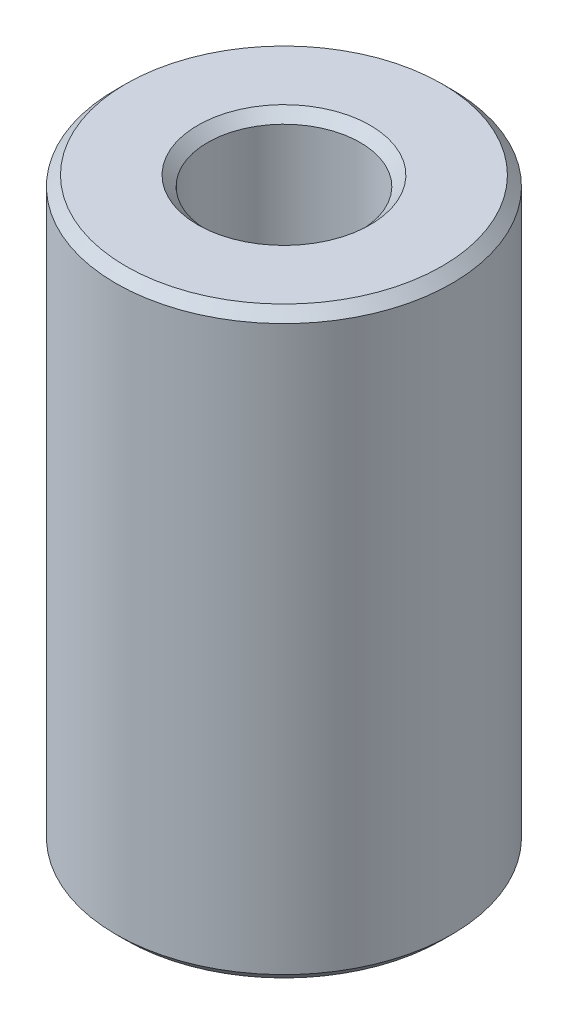
from build123d import *

# Parameters (mm, degrees)
SKETCH1_R           = 5
BOSS_EXTRUDE1_DEPTH = 17.374376269
SKETCH2_R           = 2.271521573
CUT_EXTRUDE1_DEPTH  = 19.758170239
CHAMFER1_SIZE       = 0.295600077


with BuildPart() as part:
    # Sketch1 → Boss-Extrude1 (new body)
    with BuildSketch(Plane(origin=(0, 0, 0), x_dir=(1, 0, 0), z_dir=(0, 1, 0))):
        Circle(SKETCH1_R)
    extrude(amount=BOSS_EXTRUDE1_DEPTH)

    # Sketch2 → Cut-Extrude1 (cut, through all)
    with BuildSketch(Plane(origin=(0, 0, 0), x_dir=(1, 0, 0), z_dir=(0, 1, 0))):
        Circle(SKETCH2_R)
    extrude(amount=CUT_EXTRUDE1_DEPTH, mode=Mode.SUBTRACT)

    # Chamfer1
    chamfer1_edges = [part.edges().sort_by_distance(p)[0] for p in [
        (-2.271521573, 17.374376269, 0),
        (-2.271521573, 0, 0),
        (-5, 0, 0),
        (-5, 17.374376269, 0),
    ]]
    chamfer(chamfer1_edges, length=CHAMFER1_SIZE)


solid = part.part
